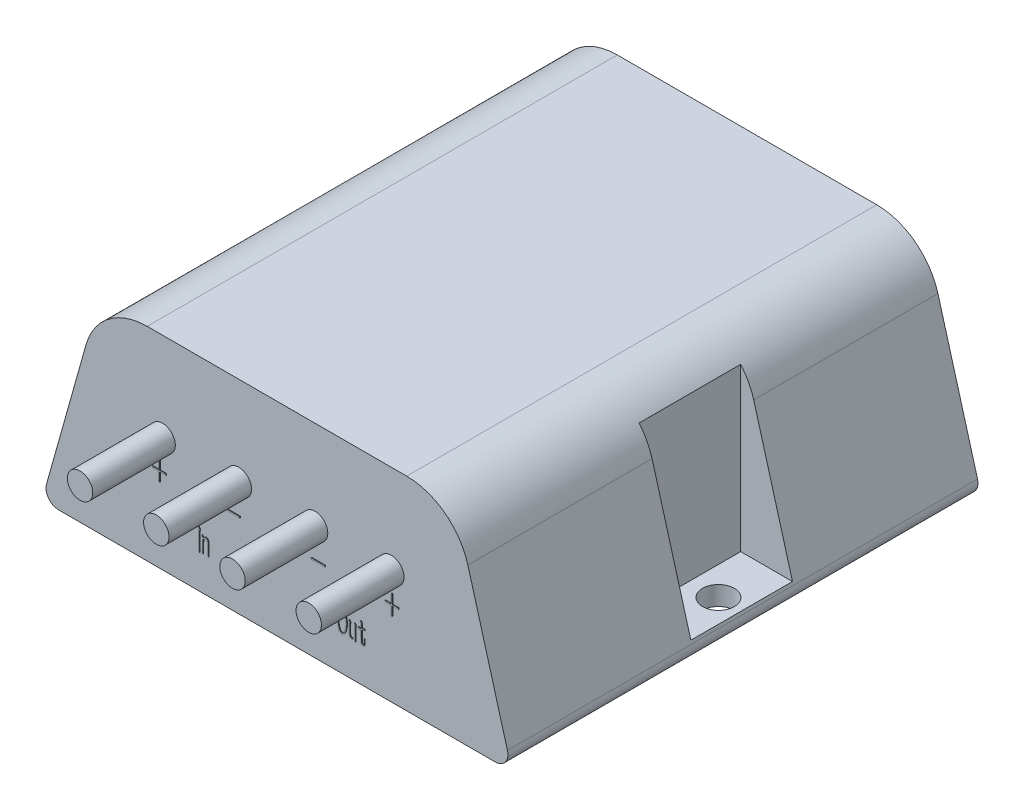
from build123d import *

# Parameters (mm, degrees)
SKETCH_3_R          = 2.5
CUT_EXTRUDE_1_DEPTH = 62.335145074
SKETCH_4_W          = 9
SKETCH_4_H          = 16
CUT_EXTRUDE_2_DEPTH = 29
SKETCH_5_R          = 2
EXTRUDE_1_DEPTH     = 13
SKETCH_6_W          = 2.164287236
SKETCH_6_H          = 0.217025357
SKETCH_6_W_2        = 2.164287237
EXTRUDE_2_DEPTH     = 37.1
FILLET_1_R          = 10
FILLET_2_R          = 2


with BuildPart() as part:
    # 草图1 → 放样1 section 0
    with BuildSketch(Plane(origin=(0, 0, 0), x_dir=(1, 0, 0), z_dir=(0, 1, 0))):
        with BuildLine():
            Line((37, -37), (-37, -37))
            Line((-37, -37), (-37, 37))
            Line((-37, 37), (37, 37))
            Line((37, 37), (37, -37))
        make_face()
    # 草图2 → 放样1 section 1
    with BuildSketch(Plane(origin=(0, 32, 0), x_dir=(1, 0, 0), z_dir=(0, 1, 0))):
        with BuildLine():
            Line((28, -37), (-28, -37))
            Line((-28, -37), (-28, 37))
            Line((-28, 37), (28, 37))
            Line((28, 37), (28, -37))
        make_face()
    loft()

    # 草图3 → 切除-拉伸1 (cut, through all)
    with BuildSketch(Plane(origin=(0, 32, 0), x_dir=(1, 0, 0), z_dir=(0, 1, 0))):
        with Locations(Location((-32.5, 0, 0), (0, 0, 270))):
            Circle(SKETCH_3_R)
        with Locations(Location((32.5, 0, 0), (0, 0, 270))):
            Circle(SKETCH_3_R)
    extrude(amount=-CUT_EXTRUDE_1_DEPTH, mode=Mode.SUBTRACT)

    # 草图4 → 切除-拉伸2 (cut)
    with BuildSketch(Plane(origin=(0, 32, 0), x_dir=(1, 0, 0), z_dir=(0, 1, 0))):
        with Locations((-32.5, 0)):
            Rectangle(SKETCH_4_W, SKETCH_4_H)
        with Locations((32.5, 0)):
            Rectangle(SKETCH_4_W, SKETCH_4_H)
    extrude(amount=-CUT_EXTRUDE_2_DEPTH, mode=Mode.SUBTRACT)

    # 草图5 → 凸台-拉伸1 (add)
    with BuildSketch(Plane.XY.offset(37)):
        with Locations(Location((-6, 18, 0), (0, 0, 180))):
            Circle(SKETCH_5_R)
        with Locations(Location((-18, 18, 0), (0, 0, 180))):
            Circle(SKETCH_5_R)
        with Locations(Location((18, 18, 0), (0, 0, 180))):
            Circle(SKETCH_5_R)
        with Locations(Location((6, 18, 0), (0, 0, 180))):
            Circle(SKETCH_5_R)
    extrude(amount=EXTRUDE_1_DEPTH)

    # 草图6 → 凸台-拉伸2 (add)
    # profile 1 of 9: a face of its own
    with BuildSketch(Plane.XY):
        Polygon((-18.521889544, 13.464881553), (-18.521889544, 14.8997846), (-18.371239639, 14.8997846), (-18.371239639, 13.464881553), (-17.364420973, 13.464881553), (-17.364420973, 13.248601988), (-18.371239639, 13.248601988), (-18.371239639, 11.813698941), (-18.521889544, 11.813698941), (-18.521889544, 13.248601988), (-19.52870821, 13.248601988), (-19.52870821, 13.464881553), align=None)
    # profile 2 of 9: a face of its own
    with BuildSketch(Plane.XY):
        with Locations((-6.848013558, 13.346673584)):
            Rectangle(SKETCH_6_W, SKETCH_6_H)
    # profile 3 of 9: a face of its own
    with BuildSketch(Plane.XY):
        with Locations((6.564302658, 13.346673584)):
            Rectangle(SKETCH_6_W_2, SKETCH_6_H)
    # profile 4 of 9: a face of its own
    with BuildSketch(Plane.XY):
        Polygon((18.087528739, 13.464881553), (18.087528739, 14.8997846), (18.238178643, 14.8997846), (18.238178643, 13.464881553), (19.244997309, 13.464881553), (19.244997309, 13.248601988), (18.238178643, 13.248601988), (18.238178643, 11.813698941), (18.087528739, 11.813698941), (18.087528739, 13.248601988), (17.080710073, 13.248601988), (17.080710073, 13.464881553), align=None)
    # profile 5 of 9: a face of its own
    with BuildSketch(Plane.XY):
        with BuildLine():
            Line((-12.284088563, 8.796013026), (-12.243815817, 8.841506313))
            Line((-12.243815817, 8.841506313), (-12.02231571, 8.543935463))
            add(Edge.make_bspline(
                [(-12.02231571, 8.543935463), (-12.026840117, 8.526971313), (-12.035194937, 8.495645127), (-12.050456446, 8.450525672), (-12.063322258, 8.402891945), (-12.072633029, 8.356786272), (-12.07828047, 8.309121491), (-12.080953471, 8.260320761), (-12.082168607, 8.199883725), (-12.082528649, 8.155627242), (-12.08272483, 8.131512706)],
                knots=[0, 0, 0, 0, 1.004175213, 1.854321033, 2.723758726, 3.82552311, 4.541751514, 5.467964897, 6.620341098, 8, 8, 8, 8], degree=3))
            Line((-12.08272483, 8.131512706), (-12.08272483, 5.926206931))
            Line((-12.08272483, 5.926206931), (-12.097640662, 5.508563633))
            add(Edge.make_bspline(
                [(-12.097640662, 5.508563633), (-12.097999267, 5.485353148), (-12.098654907, 5.442917242), (-12.106889376, 5.394288372), (-12.115409873, 5.363213769), (-12.120542221, 5.350239294), (-12.126224258, 5.34025595), (-12.13084645, 5.341682317), (-12.132692868, 5.342252105)],
                knots=[0, 0, 0, 0, 2.350389122, 4.297234295, 5.032515409, 5.553050425, 5.821457962, 6, 6, 6, 6], degree=3))
            add(Edge.make_bspline(
                [(-12.132692868, 5.342252105), (-12.134943022, 5.342935123), (-12.140488285, 5.344618346), (-12.151607261, 5.35053518), (-12.160411892, 5.370894601), (-12.165341266, 5.3875467), (-12.168490865, 5.398186475)],
                knots=[0, 0, 0, 0, 0.403031229, 0.993227006, 2.078837504, 4, 4, 4, 4], degree=3))
            Line((-12.168490865, 5.398186475), (-12.193101988, 5.463070345))
            Line((-12.193101988, 5.463070345), (-12.249036358, 5.644297705))
            add(Edge.make_bspline(
                [(-12.249036358, 5.644297705), (-12.254674449, 5.661714477), (-12.264498793, 5.692063114), (-12.278097772, 5.731007515), (-12.284850945, 5.757330776), (-12.288455025, 5.777834323), (-12.280504151, 5.798279105), (-12.270203345, 5.82625698), (-12.257295379, 5.864160284), (-12.245472944, 5.90972928), (-12.235527187, 5.957544323), (-12.228741964, 6.003405596), (-12.22420743, 6.045967568), (-12.221487877, 6.084286945), (-12.219386362, 6.127050654), (-12.219289414, 6.18226609), (-12.218140275, 6.260565881), (-12.218343961, 6.320480974), (-12.218458902, 6.354291312)],
                knots=[0, 0, 0, 0, 1.214579163, 2.116397919, 2.728090024, 3.026630229, 3.470478885, 4.138035078, 5.024200554, 6.115768324, 7.260198826, 8.260311231, 9.188705593, 10.09772701, 10.807310684, 12.027247325, 13.758158969, 16, 16, 16, 16], degree=3))
            Line((-12.218458902, 6.354291312), (-12.218458902, 8.201617117))
            add(Edge.make_bspline(
                [(-12.218458902, 8.201617117), (-12.218568165, 8.238918182), (-12.218777382, 8.310342556), (-12.225210513, 8.412809725), (-12.233795423, 8.505612327), (-12.245155491, 8.587039874), (-12.255628348, 8.654044263), (-12.261484935, 8.693588039), (-12.26395219, 8.710246991)],
                knots=[0, 0, 0, 0, 1.312774966, 2.513711841, 3.612622797, 4.592819118, 5.407184629, 6, 6, 6, 6], degree=3))
            Line((-12.26395219, 8.710246991), (-12.284088563, 8.796013026))
        make_face()
    # profile 6 of 9: a face of its own
    with BuildSketch(Plane.XY):
        with BuildLine():
            Line((-11.52487271, 7.235071197), (-11.530093251, 5.885934185))
            Line((-11.530093251, 5.885934185), (-11.539788542, 5.568972753))
            add(Edge.make_bspline(
                [(-11.539788542, 5.568972753), (-11.539942144, 5.546042557), (-11.540218935, 5.50472212), (-11.547281306, 5.457127674), (-11.554594022, 5.427466924), (-11.559508155, 5.414051207), (-11.5673464, 5.404711527), (-11.572995932, 5.406885079), (-11.575586539, 5.407881766)],
                knots=[0, 0, 0, 0, 2.34317494, 4.222424088, 4.932452798, 5.433873168, 5.74040114, 6, 6, 6, 6], degree=3))
            add(Edge.make_bspline(
                [(-11.575586539, 5.407881766), (-11.577867804, 5.408527365), (-11.584286212, 5.410343774), (-11.595141429, 5.418815743), (-11.607486541, 5.436670959), (-11.612700974, 5.453112142), (-11.615859286, 5.463070345)],
                knots=[0, 0, 0, 0, 0.396608432, 1.115869484, 2.253121063, 4, 4, 4, 4], degree=3))
            Line((-11.615859286, 5.463070345), (-11.635995659, 5.528700006))
            Line((-11.635995659, 5.528700006), (-11.696404779, 5.704706825))
            add(Edge.make_bspline(
                [(-11.696404779, 5.704706825), (-11.701472763, 5.720583395), (-11.710465225, 5.748754255), (-11.72105676, 5.786073457), (-11.727433139, 5.812813295), (-11.730708858, 5.837284491), (-11.721319864, 5.86485316), (-11.709482148, 5.89922967), (-11.694459645, 5.932811184), (-11.6849173, 5.959506055), (-11.679180237, 5.980186927), (-11.676785384, 6.000521064), (-11.673683191, 6.026598953), (-11.669951131, 6.068379804), (-11.666082383, 6.121107508), (-11.661917772, 6.174539928), (-11.658560489, 6.221253669), (-11.657650283, 6.268030633), (-11.655613124, 6.327180055), (-11.65594823, 6.37069594), (-11.656132032, 6.394564059)],
                knots=[0, 0, 0, 0, 1.279191846, 2.269755697, 2.973300866, 3.394737652, 4.139739677, 5.153545724, 6.205755023, 6.953925728, 7.328740055, 7.849455749, 8.521516328, 9.345392513, 11.06755724, 12.579023982, 13.458455443, 14.660946385, 16.168555493, 18, 18, 18, 18], degree=3))
            Line((-11.656132032, 6.394564059), (-11.656132032, 7.291005568))
            Line((-11.656132032, 7.291005568), (-11.671047864, 7.61766229))
            add(Edge.make_bspline(
                [(-11.671047864, 7.61766229), (-11.672045037, 7.638047882), (-11.673821084, 7.67435629), (-11.676101967, 7.721683731), (-11.680133478, 7.755142354), (-11.68437258, 7.772309653), (-11.685963697, 7.778753277)],
                knots=[0, 0, 0, 0, 1.511138952, 2.691462319, 3.50884966, 4, 4, 4, 4], degree=3))
            Line((-11.685963697, 7.778753277), (-11.726236443, 7.899571517))
            Line((-11.726236443, 7.899571517), (-11.680743155, 7.965201178))
            Line((-11.680743155, 7.965201178), (-11.52487271, 7.693733034))
            add(Edge.make_bspline(
                [(-11.52487271, 7.693733034), (-11.510097999, 7.709522845), (-11.481865319, 7.739695259), (-11.436634324, 7.783391585), (-11.380403424, 7.822080531), (-11.311183482, 7.852876104), (-11.239047946, 7.87994241), (-11.189904292, 7.890371574), (-11.167638531, 7.895096767)],
                knots=[0, 0, 0, 0, 0.929325523, 1.775828391, 2.697324371, 3.844075244, 5.023204402, 6, 6, 6, 6], degree=3))
            add(Edge.make_bspline(
                [(-11.167638531, 7.895096767), (-11.140880587, 7.89478481), (-11.08335497, 7.894114148), (-11.012500422, 7.872311534), (-10.954397101, 7.850006745), (-10.913080099, 7.827680531), (-10.876349819, 7.800132485), (-10.842311907, 7.769656874), (-10.812396462, 7.734184269), (-10.786231601, 7.694699655), (-10.76445605, 7.650434), (-10.739025838, 7.58354576), (-10.714965895, 7.487276507), (-10.69538881, 7.359910671), (-10.681473154, 7.220202011), (-10.67993326, 7.123486292), (-10.67914503, 7.073980211)],
                knots=[0, 0, 0, 0, 1.030239423, 2.214862157, 2.836092857, 3.43836461, 4.022881938, 4.608110309, 5.201415504, 5.811992745, 6.435376764, 7.1048659, 8.576203944, 10.260947425, 12.086083207, 14, 14, 14, 14], degree=3))
            Line((-10.67914503, 7.073980211), (-10.67914503, 6.208116158))
            Line((-10.67914503, 6.208116158), (-10.67914503, 5.579413835))
            add(Edge.make_bspline(
                [(-10.67914503, 5.579413835), (-10.679544999, 5.55842032), (-10.680306997, 5.518424632), (-10.688943473, 5.472125464), (-10.69676657, 5.440058887), (-10.702210737, 5.426800897), (-10.707582681, 5.41516373), (-10.71234242, 5.417436987), (-10.714197236, 5.418322849)],
                knots=[0, 0, 0, 0, 2.179719825, 4.152682156, 4.957445275, 5.515772157, 5.811301919, 6, 6, 6, 6], degree=3))
            add(Edge.make_bspline(
                [(-10.714197236, 5.418322849), (-10.716453778, 5.419001188), (-10.722014781, 5.420672881), (-10.73297955, 5.426775401), (-10.744021562, 5.446158865), (-10.756110178, 5.474278584), (-10.7667961, 5.507266001), (-10.772225382, 5.529423898), (-10.774606356, 5.539141089)],
                knots=[0, 0, 0, 0, 0.302763809, 0.746128762, 1.569735366, 3.070037898, 4.715085551, 6, 6, 6, 6], degree=3))
            Line((-10.774606356, 5.539141089), (-10.835015476, 5.715147907))
            add(Edge.make_bspline(
                [(-10.835015476, 5.715147907), (-10.840755377, 5.731038927), (-10.850765678, 5.758752624), (-10.863462176, 5.794854732), (-10.869815063, 5.819919959), (-10.872194096, 5.840536182), (-10.862945496, 5.858749526), (-10.854781125, 5.884670966), (-10.84165496, 5.921419077), (-10.829322542, 5.963087388), (-10.818457952, 6.00931553), (-10.81455704, 6.05791767), (-10.810185134, 6.117050922), (-10.810327219, 6.160122656), (-10.810404353, 6.183505035)],
                knots=[0, 0, 0, 0, 1.262531842, 2.201836453, 2.850271361, 3.203487677, 3.714268298, 4.324929182, 5.246640527, 6.621176111, 7.571605773, 8.785284474, 10.254825337, 12, 12, 12, 12], degree=3))
            Line((-10.810404353, 6.183505035), (-10.810404353, 6.983739427))
            add(Edge.make_bspline(
                [(-10.810404353, 6.983739427), (-10.81125166, 7.016054445), (-10.812789788, 7.074716309), (-10.813510132, 7.153804569), (-10.816422004, 7.21517333), (-10.817661226, 7.27648659), (-10.825149621, 7.349091454), (-10.842463968, 7.422839627), (-10.863973774, 7.486313385), (-10.887056314, 7.534459457), (-10.917752268, 7.579859576), (-10.952145202, 7.624135338), (-10.995581752, 7.661359297), (-11.047833126, 7.68760019), (-11.108399922, 7.700122834), (-11.150692184, 7.698866351), (-11.172859073, 7.698207784)],
                knots=[0, 0, 0, 0, 1.488766, 2.702575789, 3.642021715, 4.317900588, 5.526624181, 6.995758607, 7.795960849, 8.610128714, 9.445277991, 10.316079477, 11.185374385, 12.055799471, 12.980974859, 14, 14, 14, 14], degree=3))
            add(Edge.make_bspline(
                [(-11.172859073, 7.698207784), (-11.194200434, 7.695893106), (-11.236110055, 7.6913476), (-11.29535909, 7.668599286), (-11.351610677, 7.638748937), (-11.398884468, 7.596938584), (-11.439590752, 7.555629972), (-11.469100506, 7.51779931), (-11.490081146, 7.486316532), (-11.493559308, 7.465457497), (-11.495041046, 7.456571304)],
                knots=[0, 0, 0, 0, 1.205805155, 2.367929385, 3.554252306, 4.778748211, 5.909309449, 6.818204532, 7.496541275, 8, 8, 8, 8], degree=3))
            Line((-11.495041046, 7.456571304), (-11.52487271, 7.235071197))
        make_face()
    # profile 7 of 9: a face of its own
    with BuildSketch(Plane.XY):
        with BuildLine():
            add(Edge.make_bspline(
                [(9.631743527, 7.170187328), (9.634809663, 7.218450904), (9.641127659, 7.317901524), (9.65900599, 7.470551508), (9.682109907, 7.631251642), (9.710969782, 7.79644946), (9.747072629, 7.960133405), (9.796360811, 8.113486747), (9.855121071, 8.254750215), (9.924543666, 8.380105838), (9.997302673, 8.488284065), (10.067583211, 8.576675511), (10.13373756, 8.644636406), (10.198918561, 8.690341497), (10.260983678, 8.718561928), (10.317921786, 8.738163465), (10.371246632, 8.750943152), (10.405814084, 8.750656367), (10.422282628, 8.750519738)],
                knots=[0, 0, 0, 0, 1.217793816, 2.509352989, 3.869389901, 5.306369188, 6.732518591, 8.086865491, 9.357865112, 10.57959578, 11.689225504, 12.637700741, 13.421327601, 14.069152645, 14.629329011, 15.132240194, 15.586583926, 16, 16, 16, 16], degree=3))
            add(Edge.make_bspline(
                [(10.422282628, 8.750519738), (10.438074136, 8.747779586), (10.471651167, 8.741953278), (10.522711225, 8.721901722), (10.577885406, 8.694415989), (10.635795656, 8.657190168), (10.693984319, 8.609792603), (10.749010216, 8.550038371), (10.7987101, 8.477532158), (10.859911663, 8.364782986), (10.926503738, 8.209892088), (10.979034944, 8.04526602), (11.013102779, 7.906469635), (11.036604589, 7.795634341), (11.055552908, 7.678582185), (11.077188604, 7.515522263), (11.096643433, 7.308329968), (11.093545248, 7.141890244), (11.092003489, 7.059064379)],
                knots=[0, 0, 0, 0, 0.394985608, 0.839846589, 1.347857167, 1.916750551, 2.536277094, 3.196746505, 3.915575437, 4.701623328, 6.36253532, 8.071356979, 8.963406565, 9.891884595, 10.869033514, 11.891140732, 13.955296867, 16, 16, 16, 16], degree=3))
            add(Edge.make_bspline(
                [(11.092003489, 7.059064379), (11.090711464, 7.027979266), (11.088031328, 6.963497274), (11.079899462, 6.863946909), (11.06647188, 6.758402462), (11.046375426, 6.609014882), (11.008727918, 6.417864052), (10.956687467, 6.2284975), (10.905541927, 6.080355605), (10.861625584, 5.974803324), (10.813076375, 5.874629568), (10.759392563, 5.782242567), (10.703614579, 5.699095934), (10.643862354, 5.630169348), (10.5834687, 5.574794276), (10.520535384, 5.535739763), (10.459766118, 5.509165732), (10.403407835, 5.490680201), (10.350727056, 5.481614502), (10.317398031, 5.482691728), (10.301464388, 5.483206718)],
                knots=[0, 0, 0, 0, 0.881282943, 1.828105941, 2.82824081, 3.894865892, 6.097710261, 8.340987808, 9.452332789, 10.535200188, 11.577677107, 12.603151353, 13.560288859, 14.408919748, 15.182050945, 15.871786862, 16.496001568, 17.057257397, 17.549302039, 18, 18, 18, 18], degree=3))
            add(Edge.make_bspline(
                [(10.301464388, 5.483206718), (10.284950811, 5.485168824), (10.250285375, 5.489287691), (10.197377805, 5.506855268), (10.141475242, 5.533344768), (10.082406451, 5.568946349), (10.022606028, 5.616840429), (9.967098206, 5.680994993), (9.913088714, 5.758319996), (9.863554805, 5.849842577), (9.817222566, 5.951613124), (9.775793896, 6.061438583), (9.738424024, 6.17740887), (9.705960259, 6.298112929), (9.679946445, 6.420761278), (9.657691364, 6.541001423), (9.643189558, 6.657837987), (9.633034543, 6.77027557), (9.629440133, 6.878065084), (9.62675917, 6.980489005), (9.627301054, 7.077258886), (9.63029397, 7.139865243), (9.631743527, 7.170187328)],
                knots=[0, 0, 0, 0, 0.510534934, 1.071719088, 1.704710998, 2.411693894, 3.189282936, 4.05053371, 5.011670478, 6.086573801, 7.246791516, 8.449877322, 9.695482973, 10.994127406, 12.29322218, 13.551907867, 14.754774865, 15.913908135, 17.0238299, 18.071869134, 19.066149983, 20, 20, 20, 20], degree=3))
        make_face()
        with BuildLine():
            add(Edge.make_bspline(
                [(9.777918681, 7.159746245), (9.776507207, 7.134893063), (9.773530695, 7.082482797), (9.772380944, 6.999650832), (9.773050585, 6.908634504), (9.777842949, 6.775096112), (9.795215268, 6.598817076), (9.825829906, 6.420511943), (9.860290367, 6.278571546), (9.890020422, 6.176831326), (9.922703816, 6.080489936), (9.959460202, 5.99153528), (9.998511498, 5.911323184), (10.041610588, 5.843821973), (10.084705905, 5.787019816), (10.132655568, 5.745558203), (10.179051901, 5.713452636), (10.223918524, 5.691658098), (10.265587385, 5.674938042), (10.293378865, 5.671365222), (10.306684929, 5.669654619)],
                knots=[0, 0, 0, 0, 0.796536737, 1.679732718, 2.650327695, 3.709147218, 5.954918549, 8.313069364, 9.492003862, 10.627402775, 11.704181224, 12.745734999, 13.706334556, 14.553839847, 15.30675304, 15.97732542, 16.573080319, 17.10674674, 17.572326302, 18, 18, 18, 18], degree=3))
            add(Edge.make_bspline(
                [(10.306684929, 5.669654619), (10.32038502, 5.668848293), (10.34874322, 5.667179255), (10.392308093, 5.67573405), (10.437895732, 5.690784487), (10.485105567, 5.71506357), (10.53402925, 5.749749214), (10.580822774, 5.799842588), (10.627503853, 5.862945148), (10.67330052, 5.938116685), (10.717343788, 6.021483902), (10.756470896, 6.110800092), (10.792847918, 6.203037991), (10.832759296, 6.332342746), (10.876767353, 6.498669137), (10.911358247, 6.701821003), (10.935446273, 6.899987398), (10.948281285, 7.06086184), (10.95019027, 7.188842878), (10.947667591, 7.292058051), (10.941988574, 7.404270602), (10.934692809, 7.481950869), (10.930912502, 7.522200965)],
                knots=[0, 0, 0, 0, 0.389303871, 0.805830913, 1.253424913, 1.753499798, 2.311288848, 2.951911425, 3.695005091, 4.54345845, 5.455166886, 6.377091015, 7.318103512, 8.276048787, 10.227707478, 12.21152619, 14.136557685, 15.91040834, 16.802233067, 17.779101204, 18.849239395, 20, 20, 20, 20], degree=3))
            add(Edge.make_bspline(
                [(10.930912502, 7.522200965), (10.926751958, 7.558788343), (10.918665596, 7.62989893), (10.901788644, 7.732224212), (10.88447485, 7.82771478), (10.856181573, 7.944713064), (10.815259153, 8.086190902), (10.762642337, 8.221711292), (10.714676584, 8.323644557), (10.676011234, 8.389875907), (10.631982952, 8.443680026), (10.585996566, 8.486320462), (10.53930225, 8.518165736), (10.495417499, 8.542703578), (10.453093435, 8.558579492), (10.425122333, 8.56230361), (10.411841545, 8.564071837)],
                knots=[0, 0, 0, 0, 1.251575308, 2.432539829, 3.524812851, 4.549720602, 6.523204923, 8.527303315, 9.483611249, 10.351763581, 11.126540771, 11.838283349, 12.475927762, 13.043152764, 13.545685196, 14, 14, 14, 14], degree=3))
            add(Edge.make_bspline(
                [(10.411841545, 8.564071837), (10.398882308, 8.563130343), (10.371419876, 8.561135186), (10.328613208, 8.551542578), (10.284129082, 8.532258401), (10.234359187, 8.508989842), (10.181862201, 8.469777293), (10.128693383, 8.410629984), (10.072742589, 8.332149313), (10.012945621, 8.236824885), (9.955676758, 8.124991274), (9.908858413, 7.997438757), (9.867940819, 7.858122251), (9.839800895, 7.708905012), (9.816380685, 7.559567572), (9.798934224, 7.416957851), (9.784459573, 7.285024097), (9.780035857, 7.200296563), (9.777918681, 7.159746245)],
                knots=[0, 0, 0, 0, 0.37757334, 0.800130614, 1.267198275, 1.784369715, 2.394414205, 3.156344445, 4.08734282, 5.194407036, 6.425938495, 7.73207238, 9.1388751, 10.642807986, 12.142427514, 13.533772035, 14.819671431, 16, 16, 16, 16], degree=3))
        make_face(mode=Mode.SUBTRACT)
    # profile 8 of 9: a face of its own
    with BuildSketch(Plane.XY):
        with BuildLine():
            Line((12.256184183, 7.924928432), (12.301677471, 7.970421719))
            Line((12.301677471, 7.970421719), (12.517957036, 7.698207784))
            add(Edge.make_bspline(
                [(12.517957036, 7.698207784), (12.511937853, 7.683398625), (12.501235011, 7.657066137), (12.491559688, 7.623335927), (12.485071036, 7.595406123), (12.480123744, 7.567244676), (12.474247435, 7.530149502), (12.463853264, 7.468808573), (12.454457056, 7.384492927), (12.453041125, 7.315395477), (12.452327375, 7.280564485)],
                knots=[0, 0, 0, 0, 0.901954883, 1.603785607, 1.978329198, 2.520694973, 3.217595566, 4.099112837, 6.033621101, 8, 8, 8, 8], degree=3))
            Line((12.452327375, 7.280564485), (12.447852626, 5.700232075))
            Line((12.447852626, 5.700232075), (12.437411543, 5.503343092))
            add(Edge.make_bspline(
                [(12.437411543, 5.503343092), (12.436825787, 5.491896352), (12.435754502, 5.470961523), (12.432119953, 5.442693609), (12.430644326, 5.420504335), (12.426851323, 5.400669492), (12.421745202, 5.384694293), (12.413560246, 5.368452025), (12.399841266, 5.370260029), (12.390860566, 5.3815113), (12.379664225, 5.399091172), (12.371901702, 5.413983161), (12.367307132, 5.422797598)],
                knots=[0, 0, 0, 0, 1.638485852, 2.996610579, 4.068241337, 4.828079896, 5.839672715, 6.62244258, 6.979652832, 7.608485938, 8.584483878, 10, 10, 10, 10], degree=3))
            Line((12.367307132, 5.422797598), (12.291236389, 5.568972753))
            add(Edge.make_bspline(
                [(12.291236389, 5.568972753), (12.28604812, 5.578086625), (12.276939553, 5.594087015), (12.26770027, 5.615896288), (12.260630835, 5.631717752), (12.261188623, 5.640784869), (12.261404725, 5.644297705)],
                knots=[0, 0, 0, 0, 1.529770544, 2.685677999, 3.490797633, 4, 4, 4, 4], degree=3))
            Line((12.261404725, 5.644297705), (12.286761639, 5.689790993))
            Line((12.286761639, 5.689790993), (12.306898012, 5.795693401))
            add(Edge.make_bspline(
                [(12.306898012, 5.795693401), (12.296664801, 5.776429646), (12.277044804, 5.739495512), (12.249759879, 5.695177898), (12.22417549, 5.661651573), (12.195904574, 5.640164261), (12.163628289, 5.616482352), (12.12400146, 5.595281802), (12.078778786, 5.576473923), (12.027159464, 5.562898895), (11.969736513, 5.556052995), (11.929543196, 5.554739732), (11.908645296, 5.554056921)],
                knots=[0, 0, 0, 0, 1.312029654, 2.515536564, 3.132302309, 3.833292519, 4.638429977, 5.542167297, 6.528311998, 7.580541878, 8.742039772, 10, 10, 10, 10], degree=3))
            add(Edge.make_bspline(
                [(11.908645296, 5.554056921), (11.884745514, 5.55390524), (11.839196976, 5.553616166), (11.774349961, 5.563350883), (11.716667048, 5.580928527), (11.666729266, 5.607601399), (11.623628597, 5.640907717), (11.586694851, 5.680390094), (11.555177936, 5.725286462), (11.521747517, 5.792738794), (11.492177143, 5.884219724), (11.477981363, 5.982445982), (11.475202111, 6.068890611), (11.472791525, 6.146449854), (11.471409105, 6.236203502), (11.471054594, 6.300096847), (11.470865624, 6.334154939)],
                knots=[0, 0, 0, 0, 0.968661519, 1.846088638, 2.650099344, 3.403737013, 4.130145597, 4.850928472, 5.589769445, 6.347715959, 7.898125862, 9.468914246, 10.35757796, 11.407170027, 12.617902367, 14, 14, 14, 14], degree=3))
            Line((11.470865624, 6.334154939), (11.470865624, 7.381246352))
            add(Edge.make_bspline(
                [(11.470865624, 7.381246352), (11.470752548, 7.415316549), (11.470535278, 7.480781131), (11.464082637, 7.575046452), (11.455461908, 7.6611339), (11.444233305, 7.736854343), (11.433854728, 7.798645795), (11.427855313, 7.83468708), (11.425372336, 7.849603479)],
                knots=[0, 0, 0, 0, 1.300902488, 2.499634388, 3.606888644, 4.604547608, 5.422464392, 6, 6, 6, 6], degree=3))
            Line((11.425372336, 7.849603479), (11.400761213, 7.924928432))
            Line((11.400761213, 7.924928432), (11.445508709, 7.970421719))
            Line((11.445508709, 7.970421719), (11.667008816, 7.698207784))
            add(Edge.make_bspline(
                [(11.667008816, 7.698207784), (11.660862249, 7.682864566), (11.649569772, 7.654675996), (11.635326729, 7.611205004), (11.624337702, 7.560961799), (11.614736343, 7.510265247), (11.608235519, 7.458170457), (11.604652224, 7.409142314), (11.602488483, 7.352677373), (11.602250984, 7.312387099), (11.602124946, 7.291005568)],
                knots=[0, 0, 0, 0, 0.955062306, 1.754641118, 2.639723451, 3.924612311, 4.735340528, 5.671856169, 6.764483984, 8, 8, 8, 8], degree=3))
            Line((11.602124946, 7.291005568), (11.602124946, 6.233473072))
            add(Edge.make_bspline(
                [(11.602124946, 6.233473072), (11.602298321, 6.199632756), (11.602624009, 6.136063159), (11.611564876, 6.047515901), (11.621993763, 5.971484951), (11.640232028, 5.908495302), (11.662548484, 5.856217428), (11.690120231, 5.814061077), (11.722278856, 5.780443551), (11.759432986, 5.756410567), (11.800630046, 5.740352956), (11.844703212, 5.733210535), (11.891320222, 5.729125351), (11.92283138, 5.733176807), (11.939222751, 5.735284281)],
                knots=[0, 0, 0, 0, 1.7189745, 3.229122124, 4.521318276, 5.613109994, 6.552296241, 7.4004455, 8.159999876, 8.899528822, 9.631679654, 10.390076894, 11.16255546, 12, 12, 12, 12], degree=3))
            add(Edge.make_bspline(
                [(11.939222751, 5.735284281), (11.964971838, 5.73883051), (12.012574538, 5.745386473), (12.076452741, 5.764118175), (12.128380301, 5.786924637), (12.177809444, 5.828532325), (12.22251238, 5.890783314), (12.264727355, 5.969835535), (12.295752186, 6.049231339), (12.310714736, 6.115605952), (12.316208075, 6.169774894), (12.32031643, 6.217236538), (12.321146167, 6.273000652), (12.32158045, 6.312777711), (12.321813844, 6.334154939)],
                knots=[0, 0, 0, 0, 1.171183412, 2.165183308, 2.998184278, 3.707820518, 5.051940327, 6.427255088, 7.748233698, 8.886001551, 9.484403013, 10.204602517, 11.035106635, 12, 12, 12, 12], degree=3))
            Line((12.321813844, 6.334154939), (12.321813844, 7.300700859))
            add(Edge.make_bspline(
                [(12.321813844, 7.300700859), (12.321661364, 7.344213104), (12.321357996, 7.430783466), (12.315961539, 7.536921783), (12.310802185, 7.616178157), (12.307662325, 7.665736768), (12.302786143, 7.705432174), (12.297938721, 7.746325422), (12.290024181, 7.793537931), (12.281046719, 7.830267363), (12.276320557, 7.849603479)],
                knots=[0, 0, 0, 0, 1.89138301, 3.763026071, 4.618502937, 5.344598615, 5.921038749, 6.356690794, 7.134884036, 8, 8, 8, 8], degree=3))
            Line((12.276320557, 7.849603479), (12.256184183, 7.924928432))
        make_face()
    # profile 9 of 9: a face of its own
    with BuildSketch(Plane.XY):
        with BuildLine():
            add(Edge.make_bspline(
                [(13.426331211, 7.769057986), (13.430807675, 7.769209245), (13.438304956, 7.769462577), (13.451126264, 7.771300127), (13.468028118, 7.779563622), (13.482472926, 7.785376332), (13.491960872, 7.789194359)],
                knots=[0, 0, 0, 0, 0.775679319, 1.299124722, 2.225953526, 4, 4, 4, 4], degree=3))
            Line((13.491960872, 7.789194359), (13.587422197, 7.819026024))
            add(Edge.make_bspline(
                [(13.587422197, 7.819026024), (13.599912155, 7.822836307), (13.626186802, 7.830851855), (13.664359935, 7.846189382), (13.699604615, 7.861281805), (13.719783939, 7.874013614), (13.728376811, 7.879435144)],
                knots=[0, 0, 0, 0, 1.017936952, 2.141395217, 3.208558587, 4, 4, 4, 4], degree=3))
            Line((13.728376811, 7.879435144), (13.773870098, 7.910012599))
            Line((13.773870098, 7.910012599), (13.919299461, 7.769057986))
            add(Edge.make_bspline(
                [(13.919299461, 7.769057986), (13.924837956, 7.761680967), (13.934563928, 7.748726422), (13.940508838, 7.727512802), (13.938562158, 7.710181165), (13.93322112, 7.694931451), (13.917107969, 7.6830648), (13.903168413, 7.683206033), (13.894688338, 7.683291952)],
                knots=[0, 0, 0, 0, 1.373674801, 2.412266071, 3.197745606, 3.965371001, 4.762241242, 6, 6, 6, 6], degree=3))
            Line((13.894688338, 7.683291952), (13.818617595, 7.673596661))
            add(Edge.make_bspline(
                [(13.818617595, 7.673596661), (13.796240524, 7.669642407), (13.748945932, 7.661284977), (13.673630453, 7.647465689), (13.590646328, 7.628122422), (13.532240081, 7.614893965), (13.501656163, 7.607967)],
                knots=[0, 0, 0, 0, 0.842298951, 1.780223452, 2.837633525, 4, 4, 4, 4], degree=3))
            Line((13.501656163, 7.607967), (13.426331211, 7.593051168))
            Line((13.426331211, 7.593051168), (13.426331211, 6.132791206))
            add(Edge.make_bspline(
                [(13.426331211, 6.132791206), (13.426846804, 6.096993643), (13.427774827, 6.032561049), (13.432002154, 5.946505535), (13.440945484, 5.882038858), (13.456071393, 5.825855766), (13.486612773, 5.779691891), (13.520214086, 5.743993313), (13.55229308, 5.725564039), (13.5799321, 5.719878785), (13.610288968, 5.715992283), (13.631426039, 5.718854107), (13.642610776, 5.720368449)],
                knots=[0, 0, 0, 0, 1.99062612, 3.582959082, 4.785050357, 5.607126213, 6.792334806, 7.818522908, 8.307161749, 8.820023072, 9.375612096, 10, 10, 10, 10], degree=3))
            add(Edge.make_bspline(
                [(13.642610776, 5.720368449), (13.65390315, 5.72162206), (13.67523712, 5.723990429), (13.704626861, 5.735014144), (13.729779284, 5.750506684), (13.750368505, 5.772887948), (13.766021455, 5.802701282), (13.778453205, 5.84045379), (13.786973832, 5.886858764), (13.791564963, 5.94204839), (13.7947955, 6.0067628), (13.799620817, 6.081558535), (13.803774617, 6.166858488), (13.807141422, 6.227011741), (13.808922304, 6.258829987)],
                knots=[0, 0, 0, 0, 0.661816756, 1.250328735, 1.818761493, 2.374038654, 3.004980104, 3.772443445, 4.690165054, 5.755886687, 7.007772156, 8.478118799, 10.137090273, 12, 12, 12, 12], degree=3))
            Line((13.808922304, 6.258829987), (13.818617595, 6.560875587))
            Line((13.818617595, 6.560875587), (13.884247256, 6.560875587))
            Line((13.884247256, 6.560875587), (13.884247256, 6.264050528))
            add(Edge.make_bspline(
                [(13.884247256, 6.264050528), (13.884240286, 6.225020489), (13.884227455, 6.153175384), (13.884307164, 6.054485484), (13.884084044, 5.974179663), (13.884829775, 5.892348133), (13.880403597, 5.80361325), (13.862617321, 5.721518426), (13.842918036, 5.660586418), (13.821392898, 5.622274933), (13.796761277, 5.589062549), (13.766611359, 5.56293847), (13.732483281, 5.54296162), (13.694042212, 5.530626538), (13.652143496, 5.522608872), (13.622762661, 5.523182581), (13.607558571, 5.523479465)],
                knots=[0, 0, 0, 0, 1.824051209, 3.357648404, 4.612409746, 5.576717073, 7.183429291, 8.751149283, 9.48970251, 10.165655838, 10.795398724, 11.412912429, 12.016721546, 12.630288034, 13.291196981, 14, 14, 14, 14], degree=3))
            add(Edge.make_bspline(
                [(13.607558571, 5.523479465), (13.588360959, 5.524110573), (13.552081393, 5.525303239), (13.500620278, 5.536477478), (13.456221469, 5.556092278), (13.417409406, 5.582694784), (13.385451755, 5.618535405), (13.358753115, 5.662415946), (13.336595022, 5.714475457), (13.31850931, 5.774701405), (13.306892199, 5.843900907), (13.296804394, 5.920974539), (13.292184623, 6.006700116), (13.291143378, 6.066413352), (13.290597139, 6.097739)],
                knots=[0, 0, 0, 0, 0.926630348, 1.751142183, 2.52541162, 3.258346252, 4.006374447, 4.826150188, 5.72969289, 6.732703069, 7.856222451, 9.114864205, 10.486453688, 12, 12, 12, 12], degree=3))
            Line((13.290597139, 6.097739), (13.285376598, 7.562473712))
            Line((13.285376598, 7.562473712), (12.993026289, 7.502064592))
            add(Edge.make_bspline(
                [(12.993026289, 7.502064592), (12.977308447, 7.514923531), (12.947417263, 7.539377836), (12.905705976, 7.575265909), (12.871752603, 7.612435118), (12.85202209, 7.652366018), (12.843205792, 7.683384058), (12.83947222, 7.706689248), (12.850164766, 7.718249775), (12.858121691, 7.72167466), (12.862512758, 7.723564698)],
                knots=[0, 0, 0, 0, 1.677073101, 3.189350026, 4.543248612, 5.810307843, 6.791681809, 7.284404625, 7.605095309, 8, 8, 8, 8], degree=3))
            Line((12.862512758, 7.723564698), (12.93783771, 7.713869407))
            Line((12.93783771, 7.713869407), (13.008687912, 7.713869407))
            add(Edge.make_bspline(
                [(13.008687912, 7.713869407), (13.027844045, 7.713810618), (13.06393231, 7.713699864), (13.11423992, 7.710715807), (13.157535867, 7.709672169), (13.183006823, 7.715665627), (13.194390022, 7.718344157)],
                knots=[0, 0, 0, 0, 1.23233348, 2.321594721, 3.24990559, 4, 4, 4, 4], degree=3))
            Line((13.194390022, 7.718344157), (13.290597139, 7.73848053))
            Line((13.290597139, 7.73848053), (13.290597139, 8.126292165))
            add(Edge.make_bspline(
                [(13.290597139, 8.126292165), (13.290196365, 8.164338662), (13.289444028, 8.235759845), (13.283151463, 8.337738522), (13.274126943, 8.431486351), (13.26400304, 8.505368354), (13.257755908, 8.560196108), (13.25185985, 8.594086584), (13.248480154, 8.62151806), (13.246120798, 8.637659798), (13.245103851, 8.64461733)],
                knots=[0, 0, 0, 0, 1.752936068, 3.290625287, 4.706267004, 6.091551946, 6.726653401, 7.248323029, 7.676006595, 8, 8, 8, 8], degree=3))
            Line((13.245103851, 8.64461733), (13.219746936, 8.725162823))
            Line((13.219746936, 8.725162823), (13.265240224, 8.775876652))
            Line((13.265240224, 8.775876652), (13.486740331, 8.473831052))
            add(Edge.make_bspline(
                [(13.486740331, 8.473831052), (13.48062505, 8.456981583), (13.469465552, 8.426233757), (13.455282026, 8.38033316), (13.445588643, 8.331260421), (13.437268296, 8.290087154), (13.433431044, 8.254103566), (13.431137111, 8.226018273), (13.430046193, 8.19018078), (13.428215289, 8.146444134), (13.427861726, 8.094718289), (13.427042967, 8.03505817), (13.426117946, 7.967689471), (13.426257446, 7.92020541), (13.426331211, 7.895096767)],
                knots=[0, 0, 0, 0, 1.101499709, 2.010076481, 2.94784529, 4.173376765, 4.588341219, 5.170599297, 5.904438007, 6.790917629, 7.860280415, 9.08238009, 10.457219685, 12, 12, 12, 12], degree=3))
            Line((13.426331211, 7.895096767), (13.426331211, 7.769057986))
        make_face()
    extrude(amount=EXTRUDE_2_DEPTH)

    # 圆角1
    # the kernel refuses this fillet: 10 mm, written as the material it takes off along each edge
    with BuildSketch(Plane(origin=(-28, 32, 10.938703342), x_dir=(-0.27074557691828394, -0.962650940153899, 0), z_dir=(0, 0, -1)), Plane(origin=(28, 32, -55.938703342), x_dir=(0.27074557691828394, -0.962650940153899, 0), z_dir=(0, 0, 1)), Plane(origin=(28, 32, -10.938703342), x_dir=(0.27074557691828394, -0.962650940153899, 0), z_dir=(0, 0, 1)), Plane(origin=(-28, 32, 55.938703342), x_dir=(-0.27074557691828394, -0.962650940153899, 0), z_dir=(0, 0, -1))) as fillet_1_piece_1:
        with BuildLine():
            CenterArc((FILLET_1_R * 0.757548133662, -FILLET_1_R), FILLET_1_R, 90, 74.291362171)
            Line((-FILLET_1_R * 0.205102806492, -FILLET_1_R * 0.729254423082), (0, 0))
            Line((0, 0), (FILLET_1_R * 0.757548133662, 0))
        make_face()
    extrude(amount=66.877406683, mode=Mode.SUBTRACT)

    # 圆角2
    # the kernel refuses this fillet: 2 mm, written as the material it takes off along each edge
    with BuildSketch(Plane(origin=(-37, 0, 43.600240668), x_dir=(1, 0, 0), z_dir=(0, 0, -1)), Plane(origin=(37, 0, -43.600240668), x_dir=(-1, 0, 0), z_dir=(0, 0, 1))) as fillet_2_piece_1:
        with BuildLine():
            CenterArc((FILLET_2_R * 1.32004813366, -FILLET_2_R), FILLET_2_R, 90, 105.708637829)
            Line((FILLET_2_R * 0.357397193508, -FILLET_2_R * 1.27074557692), (0, 0))
            Line((0, 0), (FILLET_2_R * 1.32004813366, 0))
        make_face()
    extrude(amount=87.200481337, mode=Mode.SUBTRACT)


solid = part.part
